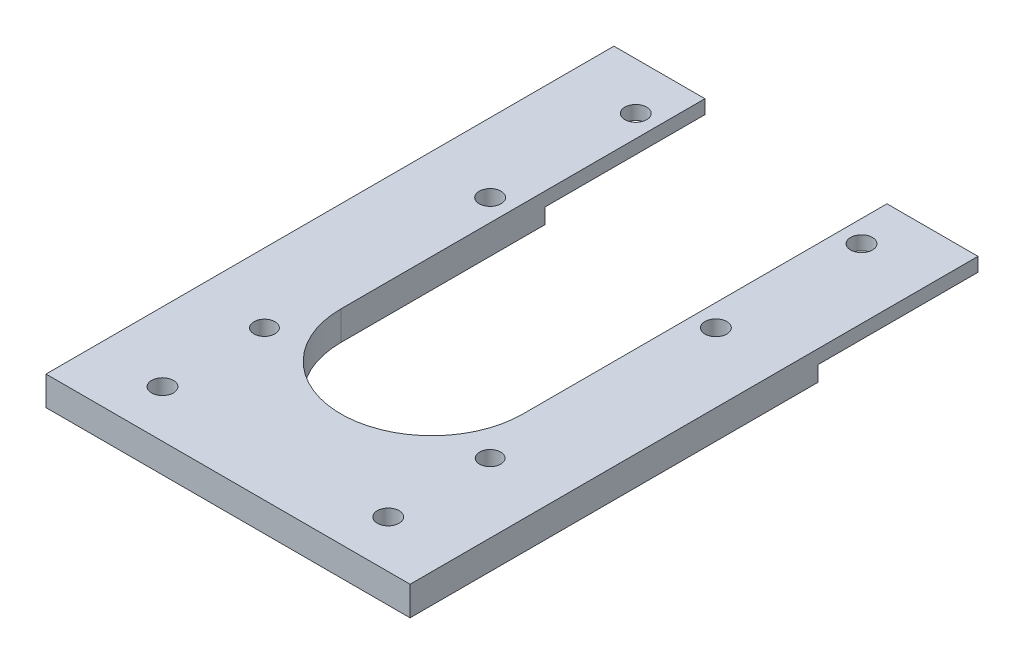
from build123d import *

# Parameters (mm, degrees)
SKETCH_1_W          = 50
SKETCH_1_H          = 25
EXTRUDE_1_DEPTH     = 4
SKETCH_2_R          = 1.45
CUT_EXTRUDE_1_DEPTH = 4
SKETCH_3_R          = 12.5
CUT_EXTRUDE_2_DEPTH = 4
SKETCH_5_W          = 50
SKETCH_5_H          = 4
EXTRUDE_2_DEPTH     = 3
SKETCH_11_R         = 1.5
CUT_EXTRUDE_4_DEPTH = 10
SKETCH_12_W         = 12.5
SKETCH_12_H         = 4
EXTRUDE_5_DEPTH     = 50
SKETCH_13_R         = 1.5
CUT_EXTRUDE_5_DEPTH = 30
SKETCH_14_R         = 1.5
CUT_EXTRUDE_6_DEPTH = 30
SKETCH_18_W         = 50
SKETCH_18_H         = 22
CUT_EXTRUDE_8_DEPTH = 2.1


with BuildPart() as part:
    # 草图1 → 凸台-拉伸1 (new body)
    with BuildSketch(Plane(origin=(0, 0, 0), x_dir=(1, 0, 0), z_dir=(0, 1, 0))):
        Rectangle(SKETCH_1_W, SKETCH_1_H)
    extrude(amount=EXTRUDE_1_DEPTH)

    # 草图2 → 切除-拉伸1 (cut)
    with BuildSketch(Plane(origin=(0, 4, 0), x_dir=(1, 0, 0), z_dir=(0, 1, 0))):
        with Locations((-15.5, 5)):
            Circle(SKETCH_2_R)
        with Locations((15.5, 5)):
            Circle(SKETCH_2_R)
    extrude(amount=-CUT_EXTRUDE_1_DEPTH, mode=Mode.SUBTRACT)

    # 草图3 → 切除-拉伸2 (cut)
    with BuildSketch(Plane(origin=(0, 4, 0), x_dir=(1, 0, 0), z_dir=(0, 1, 0))):
        with Locations((0, 12.5)):
            Circle(SKETCH_3_R)
    extrude(amount=-CUT_EXTRUDE_2_DEPTH, mode=Mode.SUBTRACT)

    # 草图5 → 凸台-拉伸2 (add)
    with BuildSketch(Plane.XY.offset(12.5)):
        with Locations((0, 2)):
            Rectangle(SKETCH_5_W, SKETCH_5_H)
    extrude(amount=EXTRUDE_2_DEPTH)

    # 草图11 → 切除-拉伸4 (cut)
    with BuildSketch(Plane(origin=(0, 4, 0), x_dir=(1, 0, 0), z_dir=(0, 1, 0))):
        with Locations((-15.5, -9)):
            Circle(SKETCH_11_R)
        with Locations((15.5, -9)):
            Circle(SKETCH_11_R)
    extrude(amount=-CUT_EXTRUDE_4_DEPTH, mode=Mode.SUBTRACT)

    # 草图12 → 凸台-拉伸5 (add)
    with BuildSketch(Plane(origin=(0, 0, -12.5), x_dir=(-1, 0, 0), z_dir=(0, 0, -1))):
        with Locations((18.75, 2)):
            Rectangle(SKETCH_12_W, SKETCH_12_H)
        with Locations((-18.75, 2)):
            Rectangle(SKETCH_12_W, SKETCH_12_H)
    extrude(amount=EXTRUDE_5_DEPTH)

    # 草图13 → 切除-拉伸5 (cut)
    with BuildSketch(Plane.XZ):
        with Locations((-15.5, -36)):
            Circle(SKETCH_13_R)
        with Locations((15.5, -36)):
            Circle(SKETCH_13_R)
    extrude(amount=-CUT_EXTRUDE_5_DEPTH, mode=Mode.SUBTRACT)

    # 草图14 → 切除-拉伸6 (cut)
    with BuildSketch(Plane.XZ):
        with Locations((-15.5, -56)):
            Circle(SKETCH_14_R)
        with Locations((15.5, -56)):
            Circle(SKETCH_14_R)
    extrude(amount=-CUT_EXTRUDE_6_DEPTH, mode=Mode.SUBTRACT)

    # 草图18 → 切除-拉伸8 (cut)
    with BuildSketch(Plane.XZ):
        with Locations((0, -51.5)):
            Rectangle(SKETCH_18_W, SKETCH_18_H)
    extrude(amount=-CUT_EXTRUDE_8_DEPTH, mode=Mode.SUBTRACT)


solid = part.part
